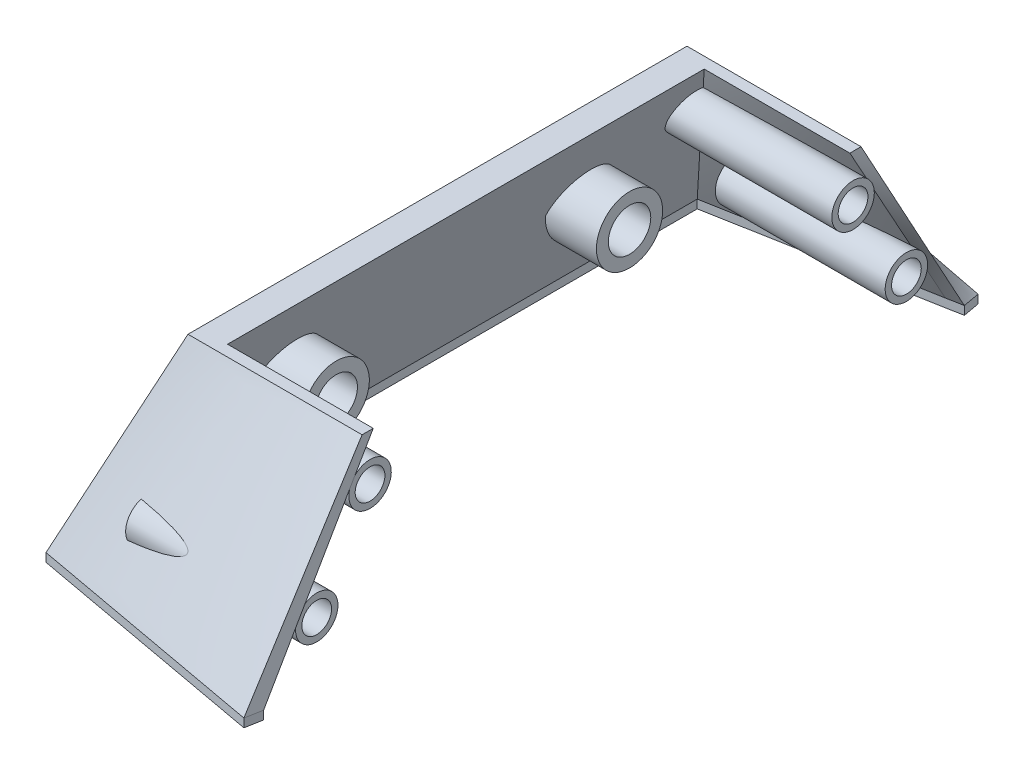
from build123d import *

# Parameters (mm, degrees)
SKETCH1_W                = 1.15
SKETCH1_H                = 38
BOSS_EXTRUDE1_DEPTH      = 0.5
BOSS_EXTRUDE2_OUTLINE_R  = 1.25
BOSS_EXTRUDE2_DEPTH      = 10
SKETCH6_R                = 0.875
CUT_EXTRUDE1_DEPTH       = 7
BOSS_EXTRUDE4_DEPTH      = 2
BOSS_EXTRUDE4_DEPTH_BACK = 1
SKETCH8_R                = 1.95
SKETCH9_R                = 1.25
CUT_EXTRUDE2_DEPTH       = 2


with BuildPart() as part:
    # Sketch1 → Boss-Extrude1 (new body)
    with BuildSketch(Plane(origin=(0, 0, 0), x_dir=(1, 0, 0), z_dir=(0, 1, 0))):
        with Locations((-0.575, 19)):
            Rectangle(SKETCH1_W, SKETCH1_H)
        Polygon((13.112661273, 40.612755906), (-1.15, 38), (0, 38), (0, 37.194026242), (13.292851335, 39.629124094), (13.15, 40.408929127), align=None)
        Polygon((0, 0), (-1.15, 0), (13.112661273, -2.612755906), (13.15, -2.408929127), (13.292851335, -1.629124094), (0, 0.805973758), align=None)
    extrude(amount=BOSS_EXTRUDE1_DEPTH)

    # Loft5: read off the stored shape, not the designer's step
    # Loft5: loft between two sections, ruled curve by curve
    loft5_from = [
        Edge.make_bspline([(0, 0.5, -37.194026242), (2.057778489, 0.5, -37.570987652), (4.115556979, 0.5, -37.947949061), (8.231113957, 0.5, -38.701871881), (10.288892446, 0.5, -39.078833291), (12.346670936, 0.5, -39.4557947)], [0, 0, 0, 0, 0.5, 0.5, 1, 1, 1, 1], 3),
        Edge.make_bspline([(12.346670936, 0.5, -39.4557947), (12.504367669, 0.5, -39.484682933), (12.662064402, 0.5, -39.513571165), (12.977457869, 0.5, -39.571347629), (13.135154602, 0.5, -39.600235862), (13.292851335, 0.5, -39.629124094)], [0, 0, 0, 0, 0.5, 0.5, 1, 1, 1, 1], 3),
        Edge.make_bspline([(13.292851335, 0.5, -39.629124094), (13.262819658, 0.5, -39.793062729), (13.232787981, 0.5, -39.957001365), (13.172724627, 0.5, -40.284878635), (13.14269295, 0.5, -40.44881727), (13.112661273, 0.5, -40.612755906)], [0, 0, 0, 0, 0.5, 0.5, 1, 1, 1, 1], 3),
        Edge.make_bspline([(13.112661273, 0.5, -40.612755906), (10.73555106, 0.5, -40.177296588), (8.358440848, 0.5, -39.741837271), (3.604220424, 0.5, -38.870918635), (1.227110212, 0.5, -38.435459318), (-1.15, 0.5, -38)], [0, 0, 0, 0, 0.5, 0.5, 1, 1, 1, 1], 3),
        Edge.make_bspline([(-1.15, 0.5, 0), (1.227110212, 0.5, 0.435459318), (3.604220424, 0.5, 0.870918635), (8.358440848, 0.5, 1.741837271), (10.73555106, 0.5, 2.177296588), (13.112661273, 0.5, 2.612755906)], [0, 0, 0, 0, 0.5, 0.5, 1, 1, 1, 1], 3),
        Edge.make_bspline([(13.112661273, 0.5, 2.612755906), (13.14269295, 0.5, 2.44881727), (13.172724627, 0.5, 2.284878635), (13.232787981, 0.5, 1.957001365), (13.262819658, 0.5, 1.793062729), (13.292851335, 0.5, 1.629124094)], [0, 0, 0, 0, 0.5, 0.5, 1, 1, 1, 1], 3),
        Edge.make_bspline([(13.292851335, 0.5, 1.629124094), (11.077376113, 0.5, 1.223274452), (8.86190089, 0.5, 0.81742481), (4.430950445, 0.5, 0.005725526), (2.215475223, 0.5, -0.400124116), (0, 0.5, -0.805973758)], [0, 0, 0, 0, 0.5, 0.5, 1, 1, 1, 1], 3),
        Edge.make_line((0, 0.5, -37.194026242), (0, 0.5, -0.805973758)),
        Edge.make_line((-1.15, 0.5, 0), (-1.15, 0.5, -38)),
    ]
    loft5_to = [
        Edge.make_bspline([(4.572715179, 11.5, -33.032352977), (6.002262649, 11.5, -33.032352977), (7.431810119, 11.5, -33.032352977), (10.29090506, 11.5, -33.032352977), (11.72045253, 11.5, -33.032352977), (13.15, 11.5, -33.032352977)], [0, 0, 0, 0, 0.5, 0.5, 1, 1, 1, 1], 3),
        Edge.make_bspline([(13.15, 11.5, -33.032352977), (13.15, 11.5, -33.141905569), (13.15, 11.5, -33.25145816), (13.15, 11.5, -33.470563343), (13.15, 11.5, -33.580115935), (13.15, 11.5, -33.689668526)], [0, 0, 0, 0, 0.5, 0.5, 1, 1, 1, 1], 3),
        Edge.make_bspline([(13.15, 11.5, -33.689668526), (11.507846202, 11.5, -33.689668526), (9.865692404, 11.5, -33.689668526), (6.581384807, 11.5, -33.689668526), (4.939231009, 11.5, -33.689668526), (3.297077211, 11.5, -33.689668526)], [0, 0, 0, 0, 0.5, 0.5, 1, 1, 1, 1], 3),
        Edge.make_bspline([(3.297077211, 11.5, -33.689668526), (3.230897676, 11.5, -33.689668526), (3.16471814, 11.5, -33.689668526), (3.03235907, 11.5, -33.689668526), (2.966179535, 11.5, -33.689668526), (2.9, 11.5, -33.689668526)], [0, 0, 0, 0, 0.5, 0.5, 1, 1, 1, 1], 3),
        Edge.make_bspline([(2.9, 11.5, -4.310331474), (4.608333333, 11.5, -4.310331474), (6.316666667, 11.5, -4.310331474), (9.733333333, 11.5, -4.310331474), (11.441666667, 11.5, -4.310331474), (13.15, 11.5, -4.310331474)], [0, 0, 0, 0, 0.5, 0.5, 1, 1, 1, 1], 3),
        Edge.make_bspline([(13.15, 11.5, -4.310331474), (13.15, 11.5, -4.419884065), (13.15, 11.5, -4.529436657), (13.15, 11.5, -4.74854184), (13.15, 11.5, -4.858094431), (13.15, 11.5, -4.967647023)], [0, 0, 0, 0, 0.5, 0.5, 1, 1, 1, 1], 3),
        Edge.make_bspline([(13.15, 11.5, -4.967647023), (11.72045253, 11.5, -4.967647023), (10.29090506, 11.5, -4.967647023), (7.431810119, 11.5, -4.967647023), (6.002262649, 11.5, -4.967647023), (4.572715179, 11.5, -4.967647023)], [0, 0, 0, 0, 0.5, 0.5, 1, 1, 1, 1], 3),
        Edge.make_line((4.572715179, 11.5, -33.032352977), (4.572715179, 11.5, -4.967647023)),
        Edge.make_line((2.9, 11.5, -4.310331474), (2.9, 11.5, -33.689668526)),
    ]
    loft5 = Solid(Shell([*[Face.make_surface_from_curves(loft5_from[k], loft5_to[k]) for k in range(9)], Face(Wire(loft5_from)), Face(Wire(loft5_to))]))
    add(loft5)

    # Boss-Extrude2: read off the stored shape, not the designer's step
    # Boss-Extrude2 outline → Boss-Extrude2 (add)
    with BuildSketch(Plane.ZY.offset(-13.15)):
        with BuildLine():
            ThreePointArc((-3.735927195, 9.443986427), (-5.852578834, 8.114733735), (-3.680886419, 9.35202066))
            Line((-3.680886419, 9.35202066), (-3.706433646, 9.399184465))
            Line((-3.706433646, 9.399184465), (-3.735927195, 9.443986427))
        make_face()
        with BuildLine():
            ThreePointArc((-0.486782416, 3.036937924), (-0.515675127, 4.067172643), (-1.308645245, 4.725516594))
            ThreePointArc((-1.308645245, 4.725516594), (-2.763557459, 2.973086258), (-0.486782416, 3.036937924))
        make_face()
        with BuildLine():
            ThreePointArc((-37.558660337, 3.164273978), (-35.225355296, 2.99647832), (-36.867350368, 4.66270759))
            ThreePointArc((-36.867350368, 4.66270759), (-37.495412118, 4.043780582), (-37.558660337, 3.164273978))
        make_face()
        with Locations((-33.220000244, 8.756663732)):
            Circle(BOSS_EXTRUDE2_OUTLINE_R)
    extrude(amount=BOSS_EXTRUDE2_DEPTH)

    # Sketch6 → Cut-Extrude1 (cut)
    with BuildSketch(Plane(origin=(13.15, 0, 0), x_dir=(0, 0, -1), z_dir=(1, 0, 0))):
        with Locations((4.779999756, 8.756663732)):
            Circle(SKETCH6_R)
        with Locations((1.639616293, 3.520129451)):
            Circle(SKETCH6_R)
        with Locations((33.220000244, 8.756663732)):
            Circle(SKETCH6_R)
        with Locations((36.360383707, 3.520129451)):
            Circle(SKETCH6_R)
    extrude(amount=-CUT_EXTRUDE1_DEPTH, mode=Mode.SUBTRACT)

    # Sketch8 → Boss-Extrude4 (add, two sides: drawn at the far end of the back side and taken through both)
    with BuildSketch(Plane.ZY.offset(-4.572715179).offset(-BOSS_EXTRUDE4_DEPTH_BACK)):
        with Locations((-10.364, 6.5)):
            Circle(SKETCH8_R)
        with Locations((-27.636, 6.5)):
            Circle(SKETCH8_R)
    extrude(amount=BOSS_EXTRUDE4_DEPTH + BOSS_EXTRUDE4_DEPTH_BACK)

    # Sketch9 → Cut-Extrude2 (cut)
    with BuildSketch(Plane(origin=(5.572715179, 0, 0), x_dir=(0, 0, -1), z_dir=(1, 0, 0))):
        with Locations((10.364, 6.5)):
            Circle(SKETCH9_R)
        with Locations((27.636, 6.5)):
            Circle(SKETCH9_R)
    extrude(amount=-CUT_EXTRUDE2_DEPTH, mode=Mode.SUBTRACT)


solid = part.part
